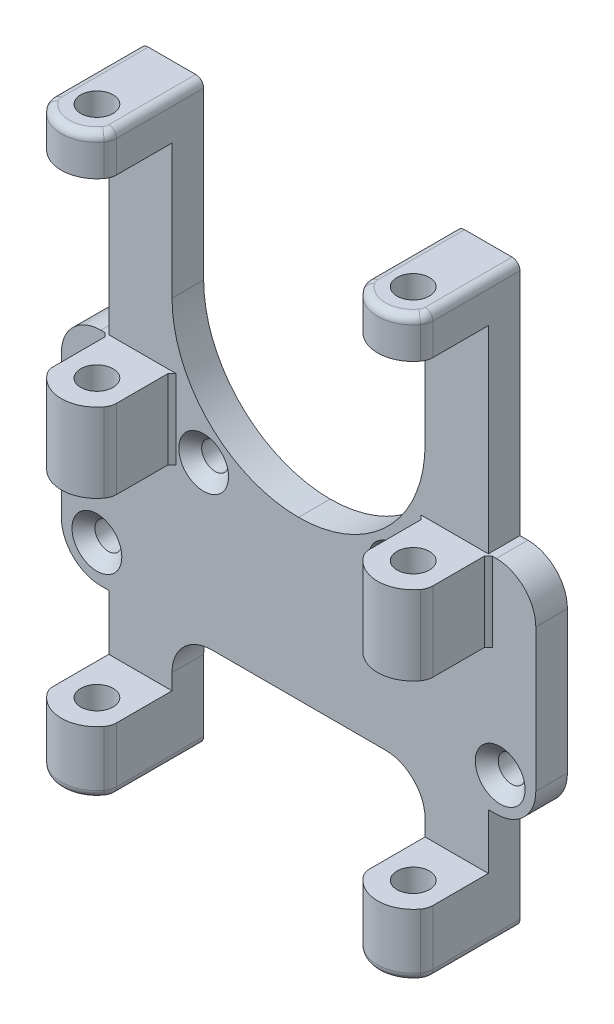
from build123d import *

# Parameters (mm, degrees)
BOSS_EXTRUDE1_DEPTH                                 = 2
SKETCH2_W                                           = 8
SKETCH2_H                                           = 73
BOSS_EXTRUDE2_DEPTH                                 = 4
CSK_FOR_M3_FLAT_COUNTERSUNK_HEAD_SCREW1_D           = 3.4
CSK_FOR_M3_FLAT_COUNTERSUNK_HEAD_SCREW1_DEPTH       = 10
CSK_FOR_M3_FLAT_COUNTERSUNK_HEAD_SCREW1_CSINK_D     = 6.3
CSK_FOR_M3_FLAT_COUNTERSUNK_HEAD_SCREW1_CSINK_ANGLE = 90
CSK_FOR_M3_FLAT_COUNTERSUNK_HEAD_SCREW1_TIP         = 1.021463052
SKETCH5_R                                           = 2.05
BOSS_EXTRUDE3_DEPTH                                 = 8
BOSS_EXTRUDE4_START                                 = -10
SKETCH6_R                                           = 2.05
BOSS_EXTRUDE4_DEPTH                                 = 10
BOSS_EXTRUDE5_START                                 = -5
SKETCH7_R                                           = 2.05
BOSS_EXTRUDE5_DEPTH                                 = 5
SKETCH13_R                                          = 2.1
CUT_EXTRUDE1_DEPTH                                  = 5
FILLET1_R                                           = 5
FILLET2_R                                           = 16
FILLET3_R                                           = 2
FILLET4_R                                           = 1
CHAMFER1_SIZE                                       = 0.5


# Read off the part's stored shape, not the designer's step: CSK for M3 Flat Countersunk Head Screw2
with BuildPart() as part:
    # Sketch1 → Boss-Extrude1 (new, symmetric)
    with BuildSketch(Plane.XY):
        with BuildLine():
            Line((-30, 14), (-16, 14))
            ThreePointArc((-16, 14), (0, 6), (16, 14))
            Line((16, 14), (30, 14))
            Line((30, 14), (30, -14))
            Line((30, -14), (-30, -14))
            Line((-30, -14), (-30, 14))
        make_face()
    extrude(amount=BOSS_EXTRUDE1_DEPTH, both=True)

    # Sketch2 → Boss-Extrude2 (add)
    with BuildSketch(Plane(origin=(0, 0, -2), x_dir=(-1, 0, 0), z_dir=(0, 0, -1))):
        with Locations((-20, 7.5)):
            Rectangle(SKETCH2_W, SKETCH2_H)
        with Locations((20, 7.5)):
            Rectangle(SKETCH2_W, SKETCH2_H)
    extrude(amount=-BOSS_EXTRUDE2_DEPTH)

    # CSK for M3 Flat Countersunk Head Screw1
    with Locations(Plane.XY.offset(2)):
        with Locations((25.5, -9.5), (-25.5, -9.5), (-12, 6), (12, 6)):
            CounterSinkHole(CSK_FOR_M3_FLAT_COUNTERSUNK_HEAD_SCREW1_D / 2, CSK_FOR_M3_FLAT_COUNTERSUNK_HEAD_SCREW1_CSINK_D / 2, depth=CSK_FOR_M3_FLAT_COUNTERSUNK_HEAD_SCREW1_DEPTH, counter_sink_angle=CSK_FOR_M3_FLAT_COUNTERSUNK_HEAD_SCREW1_CSINK_ANGLE)
            with Locations((0, 0, -(CSK_FOR_M3_FLAT_COUNTERSUNK_HEAD_SCREW1_DEPTH + CSK_FOR_M3_FLAT_COUNTERSUNK_HEAD_SCREW1_TIP / 2))):  # 118° drill point
                Cone(0, CSK_FOR_M3_FLAT_COUNTERSUNK_HEAD_SCREW1_D / 2, CSK_FOR_M3_FLAT_COUNTERSUNK_HEAD_SCREW1_TIP, mode=Mode.SUBTRACT)

    # Sketch5 → Boss-Extrude3 (add)
    # profile 1 of 2: a face of its own
    with BuildSketch(Plane(origin=(0, -29, 0), x_dir=(-1, 0, 0), z_dir=(0, -1, 0))):
        with BuildLine():
            Line((24, -2), (24, -9.561552813))
            ThreePointArc((24, -9.561552813), (20, -12), (16, -9.561552813))
            Line((16, -9.561552813), (16, -2))
            Line((16, -2), (24, -2))
        make_face()
        with Locations(Location((20, -7.5, 0), (0, 0, 90))):
            Circle(SKETCH5_R, mode=Mode.SUBTRACT)
    # profile 2 of 2: a face of its own
    with BuildSketch(Plane(origin=(0, -29, 0), x_dir=(-1, 0, 0), z_dir=(0, -1, 0))):
        with BuildLine():
            Line((-16, -9.561552813), (-16, -2))
            Line((-16, -2), (-24, -2))
            Line((-24, -2), (-24, -9.561552813))
            ThreePointArc((-24, -9.561552813), (-20, -12), (-16, -9.561552813))
        make_face()
        with Locations(Location((-20, -7.5, 0), (0, 0, 90))):
            Circle(SKETCH5_R, mode=Mode.SUBTRACT)
    extrude(amount=-BOSS_EXTRUDE3_DEPTH)

    # Sketch6 → Boss-Extrude4 (add)
    # profile 1 of 2: a face of its own
    with BuildSketch(Plane(origin=(0, 14, 0), x_dir=(1, 0, 0), z_dir=(0, 1, 0)).offset(BOSS_EXTRUDE4_START)):
        with BuildLine():
            Line((24, -2), (16, -2))
            Line((16, -2), (16, -9.561552813))
            ThreePointArc((16, -9.561552813), (20, -12), (24, -9.561552813))
            Line((24, -9.561552813), (24, -2))
        make_face()
        with Locations(Location((20, -7.5, 0), (0, 0, 90))):
            Circle(SKETCH6_R, mode=Mode.SUBTRACT)
    # profile 2 of 2: a face of its own
    with BuildSketch(Plane(origin=(0, 14, 0), x_dir=(1, 0, 0), z_dir=(0, 1, 0)).offset(BOSS_EXTRUDE4_START)):
        with BuildLine():
            Line((-24, -2), (-24, -9.561552813))
            ThreePointArc((-24, -9.561552813), (-20, -12), (-16, -9.561552813))
            Line((-16, -9.561552813), (-16, -2))
            Line((-16, -2), (-24, -2))
        make_face()
        with Locations(Location((-20, -7.5, 0), (0, 0, 90))):
            Circle(SKETCH6_R, mode=Mode.SUBTRACT)
    extrude(amount=BOSS_EXTRUDE4_DEPTH)

    # Sketch7 → Boss-Extrude5 (add)
    # profile 1 of 2: a face of its own
    with BuildSketch(Plane(origin=(0, 44, 0), x_dir=(1, 0, 0), z_dir=(0, 1, 0)).offset(BOSS_EXTRUDE5_START)):
        with BuildLine():
            Line((24, -2), (16, -2))
            Line((16, -2), (16, -9.561552813))
            ThreePointArc((16, -9.561552813), (20, -12), (24, -9.561552813))
            Line((24, -9.561552813), (24, -2))
        make_face()
        with Locations(Location((20, -7.5, 0), (0, 0, 90))):
            Circle(SKETCH7_R, mode=Mode.SUBTRACT)
    # profile 2 of 2: a face of its own
    with BuildSketch(Plane(origin=(0, 44, 0), x_dir=(1, 0, 0), z_dir=(0, 1, 0)).offset(BOSS_EXTRUDE5_START)):
        with BuildLine():
            Line((-24, -2), (-24, -9.561552813))
            ThreePointArc((-24, -9.561552813), (-20, -12), (-16, -9.561552813))
            Line((-16, -9.561552813), (-16, -2))
            Line((-16, -2), (-24, -2))
        make_face()
        with Locations(Location((-20, -7.5, 0), (0, 0, 90))):
            Circle(SKETCH7_R, mode=Mode.SUBTRACT)
    extrude(amount=BOSS_EXTRUDE5_DEPTH)

    # CSK for M3 Flat Countersunk Head Scr 2 → CSK for M3 Flat Countersunk Head Screw2 (revolve, cut)
    with BuildSketch(Plane(origin=(-20, 9, 0), x_dir=(1, 0, 0), z_dir=(0, -1, 0))):
        Polygon((1.7, 0.45), (1.7, 6.354821537), (0, 6.354821537), (0, -2), (4.15, -2), align=None)
    revolve(axis=Axis((-20, 9, 0), (0, 0, 1)), mode=Mode.SUBTRACT)

    # CSK for M3 Flat Countersunk Head Scr 3 o → CSK for M3 Flat Countersunk Head Scr 3 (revolve, cut)
    with BuildSketch(Plane(origin=(20, 9, 0), x_dir=(1, 0, 0), z_dir=(0, -1, 0))):
        Polygon((1.7, 0.45), (1.7, 6.354821537), (0, 6.354821537), (0, -2), (4.15, -2), align=None)
    revolve(axis=Axis((20, 9, 0), (0, 0, 1)), mode=Mode.SUBTRACT)

    # Sketch13 → Cut-Extrude1 (cut)
    with BuildSketch(Plane(origin=(0, 0, -2), x_dir=(-1, 0, 0), z_dir=(0, 0, -1))):
        with Locations((-20, 9)):
            Circle(SKETCH13_R)
        with Locations((20, 9)):
            Circle(SKETCH13_R)
    extrude(amount=-CUT_EXTRUDE1_DEPTH, mode=Mode.SUBTRACT)

    # Fillet1
    fillet1_edges = [part.edges().sort_by_distance(p)[0] for p in [
        (-30, 14, 0),
        (30, 14, 0),
        (30, -14, 0),
        (-30, -14, 0),
        (16, -14, 0),
        (-16, -14, 0),
    ]]
    fillet(fillet1_edges, radius=FILLET1_R)

    # Fillet2
    # the kernel refuses this fillet: 16 mm, written as the material it adds along each edge
    with BuildSketch(Plane(origin=(16, 14, 2), x_dir=(-0.894427190999915, -0.4472135954999595, 0), z_dir=(0, 0, -1))) as fillet2_piece_1:
        with BuildLine():
            CenterArc((10.733126292, 14.310835056), FILLET2_R, 206.565051177, 90)
            Line((-3.577708764, 7.155417528), (0, 0))
            ThreePointArc((0, 0), (8.94427191, -2.11145618), (17.88854382, 0))
        make_face()
    extrude(amount=4)
    with BuildSketch(Plane(origin=(-16, 14, 2), x_dir=(0.8944271909999153, -0.4472135954999591, 0), z_dir=(0, 0, -1))) as fillet2_piece_2:
        with BuildLine():
            CenterArc((10.733126292, -14.310835056), FILLET2_R, 63.434948823, 90)
            Line((-3.577708764, -7.155417528), (0, 0))
            ThreePointArc((0, 0), (8.94427191, 2.11145618), (17.88854382, 0))
        make_face()
    extrude(amount=4)

    # Fillet3
    fillet3_edges = [part.edges().sort_by_distance(p)[0] for p in [
        (-24, -25, 9.561552813),
        (-16, -25, 9.561552813),
        (16, -25, 9.561552813),
        (24, -25, 9.561552813),
        (16, 9, 9.561552813),
        (24, 9, 9.561552813),
        (-16, 9, 9.561552813),
        (-24, 9, 9.561552813),
        (16, 41.5, 9.561552813),
        (24, 41.5, 9.561552813),
        (-16, 41.5, 9.561552813),
        (-24, 41.5, 9.561552813),
    ]]
    fillet(fillet3_edges, radius=FILLET3_R)

    # Fillet4
    fillet4_edges = [part.edges().sort_by_distance(p)[0] for p in [
        (-24, 44, 3.5),
        (-20, 44, 12),
        (-16, 44, 3.5),
        (-16.102633404, 44, 9.632455532),
        (-23.897366596, 44, 9.632455532),
        (20, 44, 12),
        (16, 44, 3.5),
        (24, 44, 3.5),
        (16.102633404, 44, 9.632455532),
        (23.897366596, 44, 9.632455532),
        (-20, -29, 12),
        (-16, -29, 3.5),
        (-24, -29, 3.5),
        (-16.102633404, -29, 9.632455532),
        (-23.897366596, -29, 9.632455532),
        (20, -29, 12),
        (24, -29, 3.5),
        (16, -29, 3.5),
        (23.897366596, -29, 9.632455532),
        (16.102633404, -29, 9.632455532),
    ]]
    fillet(fillet4_edges, radius=FILLET4_R)

    # Chamfer1
    # the kernel refuses this chamfer: 0.5 mm, written as the material it adds along each edge
    with BuildSketch(Plane(origin=(16, 4, 2), x_dir=(-0.9996219169112968, 0, -0.02749587661058516), z_dir=(0, 1, 0)), Plane(origin=(-24, 4, 2), x_dir=(-0.9996219169112968, 0, -0.02749587661058968), z_dir=(0, 1, 0))) as chamfer1_piece_1:
        Polygon((CHAMFER1_SIZE * 0.999621916911, CHAMFER1_SIZE * 0.0274958766106), (-CHAMFER1_SIZE * 0.0274958766106, CHAMFER1_SIZE * 0.999621916911), (0, 0), align=None)
    extrude(amount=10)
    with BuildSketch(Plane(origin=(24, 4, 2), x_dir=(0.9996219169112968, 0, -0.027495876610585602), z_dir=(0, 1, 0)), Plane(origin=(-16, 4, 2), x_dir=(0.9996219169112968, 0, -0.027495876610590154), z_dir=(0, 1, 0))) as chamfer1_piece_2:
        Polygon((CHAMFER1_SIZE * 0.999621916911, -CHAMFER1_SIZE * 0.0274958766106), (-CHAMFER1_SIZE * 0.0274958766106, -CHAMFER1_SIZE * 0.999621916911), (0, 0), align=None)
    extrude(amount=10)


solid = part.part
